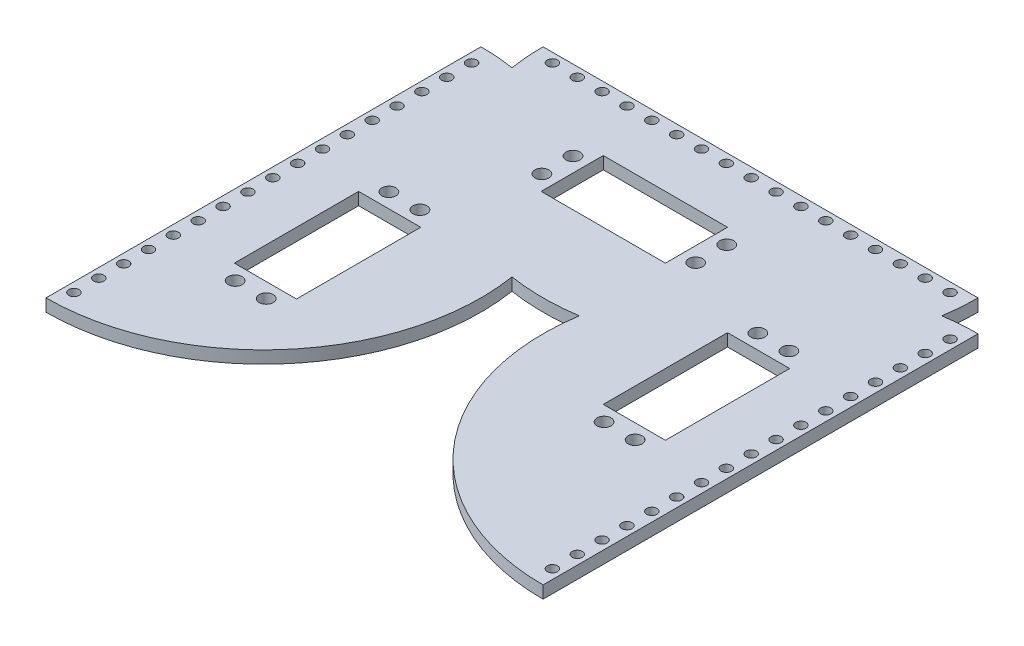
from build123d import *

# Parameters (mm, degrees)
EXTRUDE_1_DEPTH     = 4
CUT_EXTRUDE_1_DEPTH = 10
SKETCH_3_R          = 2.25
CUT_EXTRUDE_2_DEPTH = 10
SKETCH_4_R          = 1.65
CUT_EXTRUDE_3_DEPTH = 10
EXTRUDE_START       = -4
EXTRUDE_2_DEPTH     = 4
SKETCH_6_R          = 1.65
CUT_EXTRUDE_4_DEPTH = 4
SKETCH_7_W          = 40
SKETCH_7_H          = 10
SKETCH_7_R          = 2.25
CUT_EXTRUDE_5_DEPTH = 4
SKETCH_8_W          = 40
SKETCH_8_H          = 10
SKETCH_8_R          = 2.25
EXTRUDE_4_DEPTH     = 4
SKETCH_9_R          = 1.65
SKETCH_9_R_2        = 2.25
SKETCH_9_W          = 20
SKETCH_9_H          = 40
EXTRUDE_7_DEPTH     = 4
SKETCH_10_R         = 2.25
SKETCH_10_W         = 20
SKETCH_10_H         = 40
CUT_EXTRUDE_6_DEPTH = 4


with BuildPart() as part:
    # 草图1 → 凸台-拉伸1 (new body)
    with BuildSketch(Plane(origin=(0, 0, 0), x_dir=(1, 0, 0), z_dir=(0, 1, 0))):
        with BuildLine():
            Line((-50, 0), (50, 0))
            ThreePointArc((50, 0), (0, -50), (-50, 0))
        make_face()
    extrude(amount=EXTRUDE_1_DEPTH)

    # 草图2 → 切除-拉伸1 (cut)
    with BuildSketch(Plane(origin=(0, 4, 0), x_dir=(1, 0, 0), z_dir=(0, 1, 0))):
        Polygon((0, -10.623043888), (10, -10.623043888), (10, -30.623043888), (-30, -30.623043888), (-30, -10.623043888), align=None)
    extrude(amount=-CUT_EXTRUDE_1_DEPTH, mode=Mode.SUBTRACT)

    # 草图3 → 切除-拉伸2 (cut)
    with BuildSketch(Plane(origin=(0, 4, 0), x_dir=(1, 0, 0), z_dir=(0, 1, 0))):
        with Locations((-34.75, -15.623043888)):
            Circle(SKETCH_3_R)
        with Locations((-34.75, -25.623043888)):
            Circle(SKETCH_3_R)
        with Locations((14.75, -25.623043888)):
            Circle(SKETCH_3_R)
        with Locations((14.75, -15.623043888)):
            Circle(SKETCH_3_R)
    extrude(amount=-CUT_EXTRUDE_2_DEPTH, mode=Mode.SUBTRACT)

    # 草图4 → 切除-拉伸3 (cut)
    with BuildSketch(Plane(origin=(0, 4, 0), x_dir=(1, 0, 0), z_dir=(0, 1, 0))):
        with Locations((0, -3)):
            Circle(SKETCH_4_R)
        with Locations((8, -3)):
            Circle(SKETCH_4_R)
        with Locations((16, -3)):
            Circle(SKETCH_4_R)
        with Locations((24, -3)):
            Circle(SKETCH_4_R)
        with Locations((32, -3)):
            Circle(SKETCH_4_R)
        with Locations((40, -3)):
            Circle(SKETCH_4_R)
        with Locations((-40, -3)):
            Circle(SKETCH_4_R)
        with Locations((-32, -3)):
            Circle(SKETCH_4_R)
        with Locations((-24, -3)):
            Circle(SKETCH_4_R)
        with Locations((-16, -3)):
            Circle(SKETCH_4_R)
        with Locations((-8, -3)):
            Circle(SKETCH_4_R)
    extrude(amount=-CUT_EXTRUDE_3_DEPTH, mode=Mode.SUBTRACT)

    # 草图5 → 凸台-拉伸2 (add)
    with BuildSketch(Plane(origin=(0, 4, 0), x_dir=(1, 0, 0), z_dir=(0, 1, 0)).offset(EXTRUDE_START)):
        with BuildLine():
            Line((-50, 0), (-70, 0))
            ThreePointArc((-70, 0), (0, -70), (70, 0))
            Line((70, 0), (50, 0))
            ThreePointArc((50, 0), (0, -50), (-50, 0))
        make_face()
    extrude(amount=EXTRUDE_2_DEPTH)

    # 草图6 → 切除-拉伸4 (cut)
    with BuildSketch(Plane(origin=(0, 4, 0), x_dir=(1, 0, 0), z_dir=(0, 1, 0))):
        with Locations((0, -3)):
            Circle(SKETCH_6_R)
        with Locations((8, -3)):
            Circle(SKETCH_6_R)
        with Locations((16, -3)):
            Circle(SKETCH_6_R)
        with Locations((24, -3)):
            Circle(SKETCH_6_R)
        with Locations((32, -3)):
            Circle(SKETCH_6_R)
        with Locations((40, -3)):
            Circle(SKETCH_6_R)
        with Locations((48, -3)):
            Circle(SKETCH_6_R)
        with Locations((56, -3)):
            Circle(SKETCH_6_R)
        with Locations((64, -3)):
            Circle(SKETCH_6_R)
        with Locations((-8, -3)):
            Circle(SKETCH_6_R)
        with Locations((-16, -3)):
            Circle(SKETCH_6_R)
        with Locations((-24, -3)):
            Circle(SKETCH_6_R)
        with Locations((-32, -3)):
            Circle(SKETCH_6_R)
        with Locations((-40, -3)):
            Circle(SKETCH_6_R)
        with Locations((-48, -3)):
            Circle(SKETCH_6_R)
        with Locations((-56, -3)):
            Circle(SKETCH_6_R)
        with Locations((-64, -3)):
            Circle(SKETCH_6_R)
    extrude(amount=-CUT_EXTRUDE_4_DEPTH, mode=Mode.SUBTRACT)

    # 草图7 → 切除-拉伸5 (cut)
    with BuildSketch(Plane(origin=(0, 4, 0), x_dir=(1, 0, 0), z_dir=(0, 1, 0))):
        with Locations((-10, -35.623043888)):
            Rectangle(SKETCH_7_W, SKETCH_7_H)
        with Locations((14.75, -35.623043888)):
            Circle(SKETCH_7_R)
        with Locations((-34.75, -35.623043888)):
            Circle(SKETCH_7_R)
    extrude(amount=-CUT_EXTRUDE_5_DEPTH, mode=Mode.SUBTRACT)

    # 草图8 → 凸台-拉伸4 (add)
    with BuildSketch(Plane(origin=(0, 4, 0), x_dir=(1, 0, 0), z_dir=(0, 1, 0))):
        with Locations((-10, -15.623043888)):
            Rectangle(SKETCH_8_W, SKETCH_8_H)
        with Locations((-34.75, -15.623043888)):
            Circle(SKETCH_8_R)
        with Locations((14.75, -15.623043888)):
            Circle(SKETCH_8_R)
    extrude(amount=-EXTRUDE_4_DEPTH)

    # 草图9 → 凸台-拉伸7 (add)
    # profile 1 of 2: a face of its own
    with BuildSketch(Plane(origin=(0, 4, 0), x_dir=(1, 0, 0), z_dir=(0, 1, 0))):
        with BuildLine():
            ThreePointArc((-80, -150), (-18.127603377, -112.738456532), (-22.125520932, -40.623043888))
            Line((-22.125520932, -40.623043888), (-30, -40.623043888))
            Line((-30, -40.623043888), (-30, -31.010205144))
            ThreePointArc((-30, -31.010205144), (-31.779769317, -29.257420711), (-33.620943969, -27.569253661))
            ThreePointArc((-33.620943969, -27.569253661), (-36.189210789, -27.352544482), (-36.868960897, -24.866403474))
            ThreePointArc((-36.868960897, -24.866403474), (-57.189385769, -13.820880344), (-80, -10))
            Line((-80, -10), (-80, -150))
        make_face()
        with Locations((-77, -144)):
            Circle(SKETCH_9_R, mode=Mode.SUBTRACT)
        with Locations((-77, -136)):
            Circle(SKETCH_9_R, mode=Mode.SUBTRACT)
        with Locations((-77, -128)):
            Circle(SKETCH_9_R, mode=Mode.SUBTRACT)
        with Locations((-77, -120)):
            Circle(SKETCH_9_R, mode=Mode.SUBTRACT)
        with Locations((-77, -112)):
            Circle(SKETCH_9_R, mode=Mode.SUBTRACT)
        with Locations((-77, -104)):
            Circle(SKETCH_9_R, mode=Mode.SUBTRACT)
        with Locations((-54.376956112, -114.75)):
            Circle(SKETCH_9_R_2, mode=Mode.SUBTRACT)
        with Locations((-44.376956112, -114.75)):
            Circle(SKETCH_9_R_2, mode=Mode.SUBTRACT)
        with Locations((-77, -96)):
            Circle(SKETCH_9_R, mode=Mode.SUBTRACT)
        with Locations((-77, -88)):
            Circle(SKETCH_9_R, mode=Mode.SUBTRACT)
        with Locations((-77, -80)):
            Circle(SKETCH_9_R, mode=Mode.SUBTRACT)
        with Locations((-49.376956112, -90)):
            Rectangle(SKETCH_9_W, SKETCH_9_H, mode=Mode.SUBTRACT)
        with Locations((-77, -72)):
            Circle(SKETCH_9_R, mode=Mode.SUBTRACT)
        with Locations((-77, -64)):
            Circle(SKETCH_9_R, mode=Mode.SUBTRACT)
        with Locations((-54.376956112, -65.25)):
            Circle(SKETCH_9_R_2, mode=Mode.SUBTRACT)
        with Locations((-44.376956112, -65.25)):
            Circle(SKETCH_9_R_2, mode=Mode.SUBTRACT)
        with Locations((-77, -56)):
            Circle(SKETCH_9_R, mode=Mode.SUBTRACT)
        with Locations((-77, -48)):
            Circle(SKETCH_9_R, mode=Mode.SUBTRACT)
        with Locations((-77, -40)):
            Circle(SKETCH_9_R, mode=Mode.SUBTRACT)
        with Locations((-77, -32)):
            Circle(SKETCH_9_R, mode=Mode.SUBTRACT)
        with Locations((-77, -24)):
            Circle(SKETCH_9_R, mode=Mode.SUBTRACT)
        with Locations((-77, -16)):
            Circle(SKETCH_9_R, mode=Mode.SUBTRACT)
        with Locations((-34.75, -35.623043888)):
            Circle(SKETCH_9_R_2, mode=Mode.SUBTRACT)
    # profile 2 of 2: a face of its own
    with BuildSketch(Plane(origin=(0, 4, 0), x_dir=(1, 0, 0), z_dir=(0, 1, 0))):
        with BuildLine():
            ThreePointArc((80, -10), (10, -80), (80, -150))
            Line((80, -150), (80, -80))
            Line((80, -80), (80, -10))
        make_face()
        with Locations((77, -144)):
            Circle(SKETCH_9_R, mode=Mode.SUBTRACT)
        with Locations((77, -136)):
            Circle(SKETCH_9_R, mode=Mode.SUBTRACT)
        with Locations((77, -128)):
            Circle(SKETCH_9_R, mode=Mode.SUBTRACT)
        with Locations((77, -120)):
            Circle(SKETCH_9_R, mode=Mode.SUBTRACT)
        with Locations((77, -112)):
            Circle(SKETCH_9_R, mode=Mode.SUBTRACT)
        with Locations((77, -104)):
            Circle(SKETCH_9_R, mode=Mode.SUBTRACT)
        with Locations((44.376956112, -94.75)):
            Circle(SKETCH_9_R_2, mode=Mode.SUBTRACT)
        with Locations((54.376956112, -94.75)):
            Circle(SKETCH_9_R_2, mode=Mode.SUBTRACT)
        with Locations((77, -96)):
            Circle(SKETCH_9_R, mode=Mode.SUBTRACT)
        with Locations((77, -88)):
            Circle(SKETCH_9_R, mode=Mode.SUBTRACT)
        with Locations((49.376956112, -70)):
            Rectangle(SKETCH_9_W, SKETCH_9_H, mode=Mode.SUBTRACT)
        with Locations((77, -80)):
            Circle(SKETCH_9_R, mode=Mode.SUBTRACT)
        with Locations((77, -72)):
            Circle(SKETCH_9_R, mode=Mode.SUBTRACT)
        with Locations((77, -64)):
            Circle(SKETCH_9_R, mode=Mode.SUBTRACT)
        with Locations((44.376956112, -45.25)):
            Circle(SKETCH_9_R_2, mode=Mode.SUBTRACT)
        with Locations((54.376956112, -45.25)):
            Circle(SKETCH_9_R_2, mode=Mode.SUBTRACT)
        with Locations((77, -56)):
            Circle(SKETCH_9_R, mode=Mode.SUBTRACT)
        with Locations((77, -48)):
            Circle(SKETCH_9_R, mode=Mode.SUBTRACT)
        with Locations((77, -40)):
            Circle(SKETCH_9_R, mode=Mode.SUBTRACT)
        with Locations((77, -32)):
            Circle(SKETCH_9_R, mode=Mode.SUBTRACT)
        with Locations((77, -24)):
            Circle(SKETCH_9_R, mode=Mode.SUBTRACT)
        with Locations((77, -16)):
            Circle(SKETCH_9_R, mode=Mode.SUBTRACT)
    extrude(amount=-EXTRUDE_7_DEPTH)

    # 草图10 → 切除-拉伸6 (cut)
    with BuildSketch(Plane(origin=(0, 4, 0), x_dir=(1, 0, 0), z_dir=(0, 1, 0))):
        with Locations((54.376956112, -45.25)):
            Circle(SKETCH_10_R)
        with Locations((44.376956112, -45.25)):
            Circle(SKETCH_10_R)
        with Locations((49.376956112, -70)):
            Rectangle(SKETCH_10_W, SKETCH_10_H)
    extrude(amount=-CUT_EXTRUDE_6_DEPTH, mode=Mode.SUBTRACT)


solid = part.part
